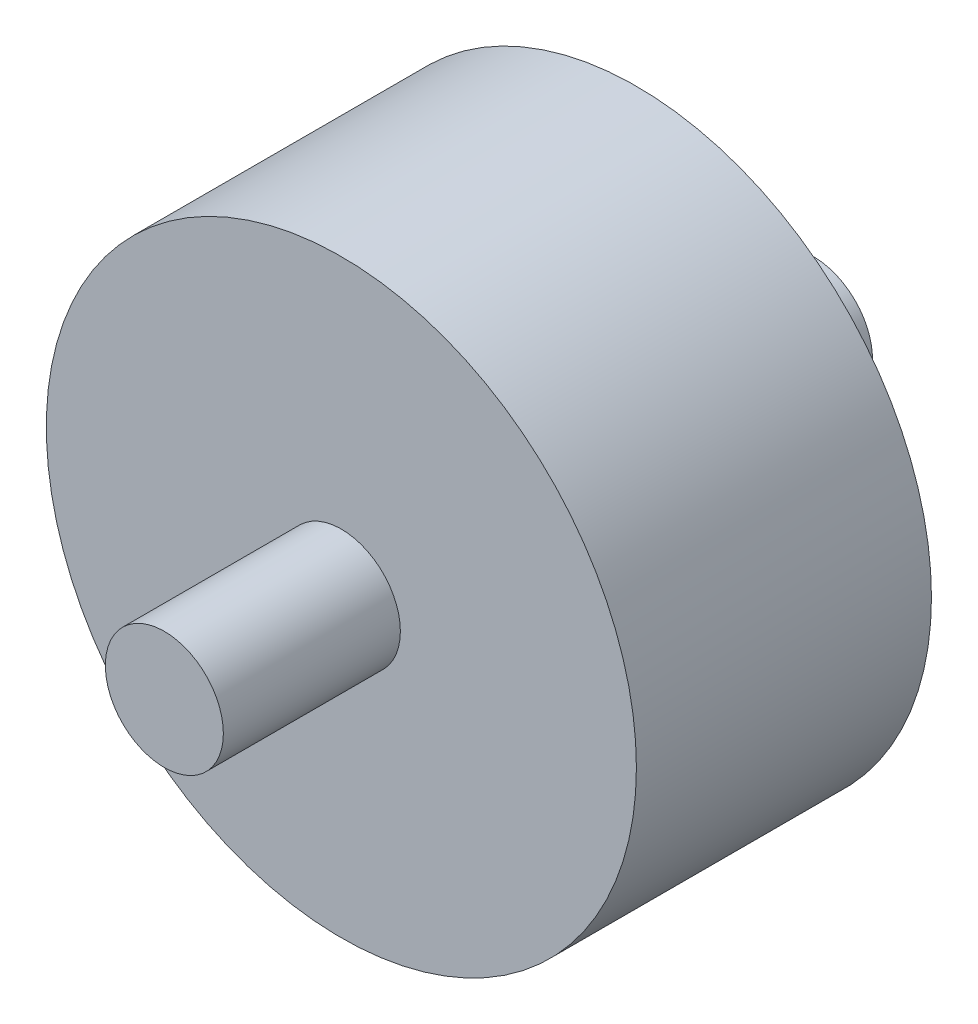
from build123d import *

# Parameters (mm, degrees)
SKETCH1_R           = 50
BOSS_EXTRUDE1_DEPTH = 25
SKETCH2_R           = 10
BOSS_EXTRUDE2_DEPTH = 30
BOSS_EXTRUDE3_START = 30
SKETCH3_R           = 10
BOSS_EXTRUDE3_DEPTH = 30


with BuildPart() as part:
    # Sketch1 → Boss-Extrude1 (new, symmetric)
    with BuildSketch(Plane.XY):
        Circle(SKETCH1_R)
    extrude(amount=BOSS_EXTRUDE1_DEPTH, both=True)

    # Sketch2 → Boss-Extrude2 (add)
    with BuildSketch(Plane(origin=(0, 0, -25), x_dir=(-1, 0, 0), z_dir=(0, 0, -1))):
        Circle(SKETCH2_R)
    extrude(amount=BOSS_EXTRUDE2_DEPTH)

    # Sketch3 → Boss-Extrude3 (add)
    with BuildSketch(Plane.XY.offset(25).offset(BOSS_EXTRUDE3_START)):
        Circle(SKETCH3_R)
    extrude(amount=-BOSS_EXTRUDE3_DEPTH)


solid = part.part
